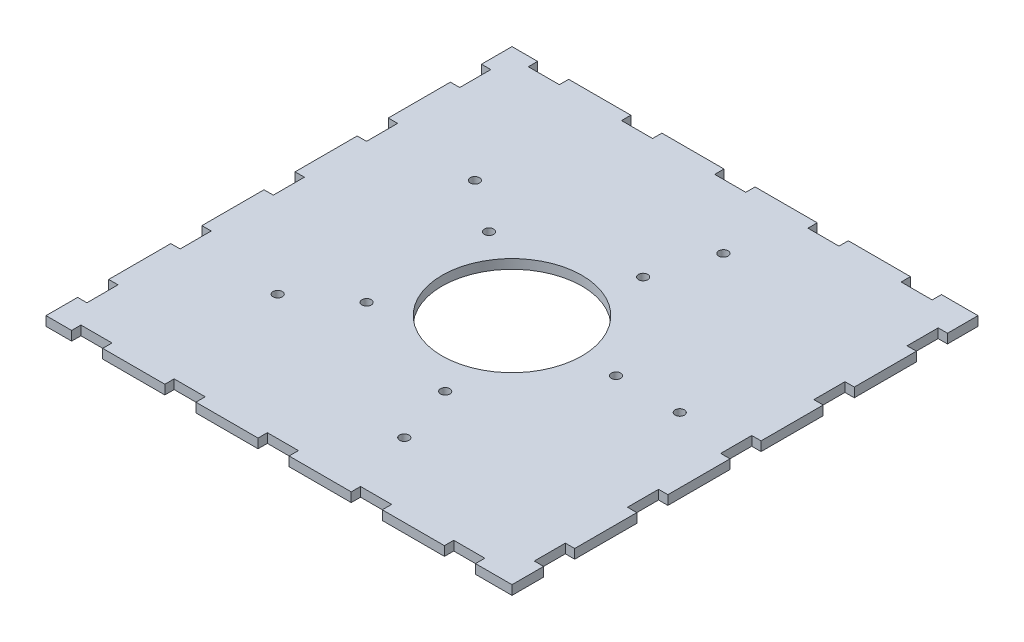
from build123d import *

# Parameters (mm, degrees)
SKETCH1_W           = 150
SKETCH1_H           = 150
BOSS_EXTRUDE1_DEPTH = 3
SKETCH2_R           = 22.5
CUT_EXTRUDE1_DEPTH  = 3
SKETCH3_W           = 10
SKETCH3_H           = 3
CUT_EXTRUDE2_DEPTH  = 3
LPATTERN1_COUNT     = 5
LPATTERN1_PITCH     = 30
SKETCH4_W           = 3
SKETCH4_H           = 10
CUT_EXTRUDE3_DEPTH  = 3
LPATTERN2_COUNT     = 5
LPATTERN2_PITCH     = 30
SKETCH5_R           = 1.5
CUT_EXTRUDE4_DEPTH  = 10


with BuildPart() as part:
    # Sketch1 → Boss-Extrude1 (new body)
    with BuildSketch(Plane(origin=(0, 0, 0), x_dir=(-1, 0, 0), z_dir=(0, 1, 0))):
        Rectangle(SKETCH1_W, SKETCH1_H)
    extrude(amount=BOSS_EXTRUDE1_DEPTH)

    # Sketch2 → Cut-Extrude1 (cut)
    with BuildSketch(Plane(origin=(0, 3, 0), x_dir=(1, 0, 0), z_dir=(0, 1, 0))):
        Circle(SKETCH2_R)
    extrude(amount=-CUT_EXTRUDE1_DEPTH, mode=Mode.SUBTRACT)

    # Sketch3 → Cut-Extrude2 (cut)
    with BuildSketch(Plane(origin=(0, 3, 0), x_dir=(1, 0, 0), z_dir=(0, 1, 0))):
        with Locations((-61.749963879, 73.5)):
            Rectangle(SKETCH3_W, SKETCH3_H)
        with Locations((-61.749963879, -73.5)):
            Rectangle(SKETCH3_W, SKETCH3_H)
    cut_extrude2 = extrude(amount=-CUT_EXTRUDE2_DEPTH, mode=Mode.SUBTRACT)

    # LPattern1: Cut-Extrude2 ×5
    with Locations(*[(i * LPATTERN1_PITCH, 0, 0) for i in range(1, LPATTERN1_COUNT)]):
        add(cut_extrude2, mode=Mode.SUBTRACT)

    # Sketch4 → Cut-Extrude3 (cut)
    with BuildSketch(Plane(origin=(0, 3, 0), x_dir=(1, 0, 0), z_dir=(0, 1, 0))):
        with Locations((-73.5, -59.825317059)):
            Rectangle(SKETCH4_W, SKETCH4_H)
        with Locations((73.5, -59.825317059)):
            Rectangle(SKETCH4_W, SKETCH4_H)
    cut_extrude3 = extrude(amount=-CUT_EXTRUDE3_DEPTH, mode=Mode.SUBTRACT)

    # LPattern2: Cut-Extrude3 ×5
    with Locations(*[(0, 0, -i * LPATTERN2_PITCH) for i in range(1, LPATTERN2_COUNT)]):
        add(cut_extrude3, mode=Mode.SUBTRACT)

    # Sketch5 → Cut-Extrude4 (cut)
    with BuildSketch(Plane(origin=(0, 0, 0), x_dir=(-1, 0, 0), z_dir=(0, -1, 0))):
        with Locations((-33.5, 0)):
            Circle(SKETCH5_R)
        with Locations((-10.352069312, 31.860393296)):
            Circle(SKETCH5_R)
        with Locations((27.102069312, 19.690805952)):
            Circle(SKETCH5_R)
        with Locations((27.102069312, -19.690805952)):
            Circle(SKETCH5_R)
        with Locations((-10.352069312, -31.860393296)):
            Circle(SKETCH5_R)
        with Locations((-54, 0)):
            Circle(SKETCH5_R)
        with Locations((-16.686917696, 51.35705188)):
            Circle(SKETCH5_R)
        with Locations((43.686917696, 31.740403624)):
            Circle(SKETCH5_R)
        with Locations((43.686917696, -31.740403624)):
            Circle(SKETCH5_R)
        with Locations((-16.686917696, -51.35705188)):
            Circle(SKETCH5_R)
    extrude(amount=-CUT_EXTRUDE4_DEPTH, mode=Mode.SUBTRACT)


solid = part.part
